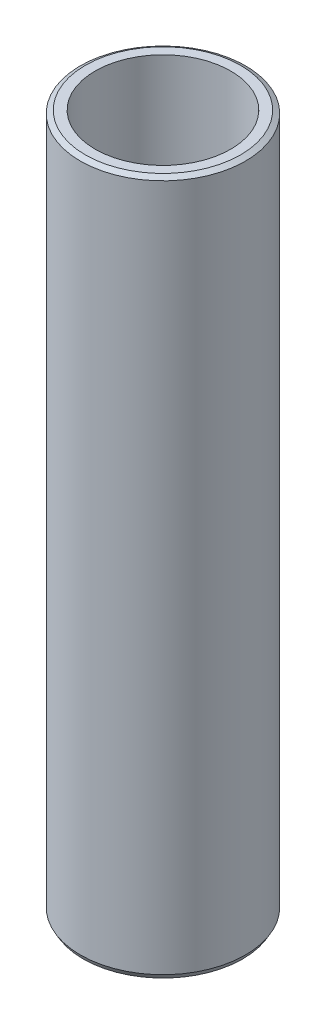
from build123d import *
from OCP.BRepFilletAPI import BRepFilletAPI_MakeChamfer

# Parameters (mm, degrees)
SKETCH1_R           = 37.5
BOSS_EXTRUDE1_DEPTH = 315.748278689
SKETCH2_R           = 30.784176451
CUT_EXTRUDE1_DEPTH  = 321.171009767
CHAMFER1_SIZE       = 1.305321454
CHAMFER1_SIZE2      = 2.260883078


with BuildPart() as part:
    # Sketch1 → Boss-Extrude1 (new body)
    with BuildSketch(Plane(origin=(0, 0, 0), x_dir=(1, 0, 0), z_dir=(0, 1, 0))):
        Circle(SKETCH1_R)
    extrude(amount=BOSS_EXTRUDE1_DEPTH)

    # Sketch2 → Cut-Extrude1 (cut, through all)
    with BuildSketch(Plane(origin=(0, 0, 0), x_dir=(1, 0, 0), z_dir=(0, 1, 0))):
        Circle(SKETCH2_R)
    extrude(amount=CUT_EXTRUDE1_DEPTH, mode=Mode.SUBTRACT)

    # Chamfer1: one chamfer whose edges measure the first distance from different faces: ONE call of the kernel's chamfer builder (chamfer() names one face for all edges)
    chamfer1_edges_1 = [part.edges().sort_by_distance(p)[0] for p in [
        (-37.5, 315.748278689, 0),
    ]]
    chamfer1_side_1 = [part.faces().sort_by_distance(p)[0] for p in [
        (-37.5, 157.874139345, 0),
    ]]
    chamfer1_edges_2 = [part.edges().sort_by_distance(p)[0] for p in [
        (-37.5, 0, 0),
    ]]
    chamfer1_side_2 = [part.faces().sort_by_distance(p)[0] for p in [
        (-36.439339828, 0, 0),
    ]]
    chamfer1 = BRepFilletAPI_MakeChamfer(part.part.solid().wrapped)
    for e in chamfer1_edges_1:
        chamfer1.Add(CHAMFER1_SIZE, CHAMFER1_SIZE2, e.wrapped, chamfer1_side_1[0].wrapped)  # the first distance lies on this face
    for e in chamfer1_edges_2:
        chamfer1.Add(CHAMFER1_SIZE, CHAMFER1_SIZE2, e.wrapped, chamfer1_side_2[0].wrapped)  # the first distance lies on this face
    add(Compound.cast(chamfer1.Shape()), mode=Mode.REPLACE)


solid = part.part
